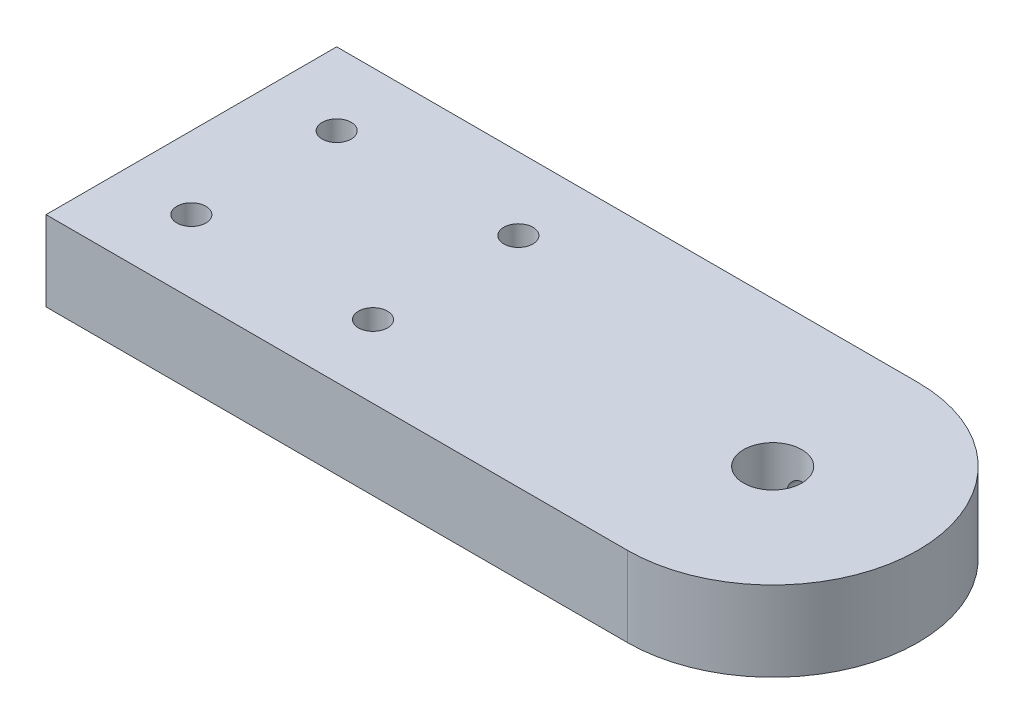
from build123d import *

# Parameters (mm, degrees)
SKETCH1_R             = 2
SKETCH1_R_2           = 4
BOSS_EXTRUDE1_DEPTH   = 11
M4_TAPPED_HOLE1_D     = 3.3
M4_TAPPED_HOLE1_DEPTH = 20
M4_TAPPED_HOLE1_TIP   = 0.991420021


with BuildPart() as part:
    # Sketch1 → Boss-Extrude1 (new body)
    with BuildSketch(Plane(origin=(0, 0, 0), x_dir=(1, 0, 0), z_dir=(0, 1, 0))):
        with BuildLine():
            Line((0, 20), (-80, 20))
            Line((-80, 20), (-80, -5))
            Line((-80, -5), (-80, -20))
            Line((-80, -20), (0, -20))
            ThreePointArc((0, -20), (14.142135607, -14.14213564), (20, -4.7e-08))
            ThreePointArc((20, -4.7e-08), (14.14213564, 14.142135607), (0, 20))
        make_face()
        with Locations((-70, -10)):
            Circle(SKETCH1_R, mode=Mode.SUBTRACT)
        with Locations((-45, -10)):
            Circle(SKETCH1_R, mode=Mode.SUBTRACT)
        with Locations((-70, 10)):
            Circle(SKETCH1_R, mode=Mode.SUBTRACT)
        with Locations((-45, 10)):
            Circle(SKETCH1_R, mode=Mode.SUBTRACT)
        Circle(SKETCH1_R_2, mode=Mode.SUBTRACT)
    extrude(amount=BOSS_EXTRUDE1_DEPTH)

    # M4 Tapped Hole1
    with Locations(Plane(origin=(0, 0, -20), x_dir=(-1, 0, 0), z_dir=(0, 0, -1))):
        with Locations((0, 5.5)):
            Hole(M4_TAPPED_HOLE1_D / 2, depth=M4_TAPPED_HOLE1_DEPTH)
            with Locations((0, 0, -(M4_TAPPED_HOLE1_DEPTH + M4_TAPPED_HOLE1_TIP / 2))):  # 118° drill point
                Cone(0, M4_TAPPED_HOLE1_D / 2, M4_TAPPED_HOLE1_TIP, mode=Mode.SUBTRACT)


solid = part.part
